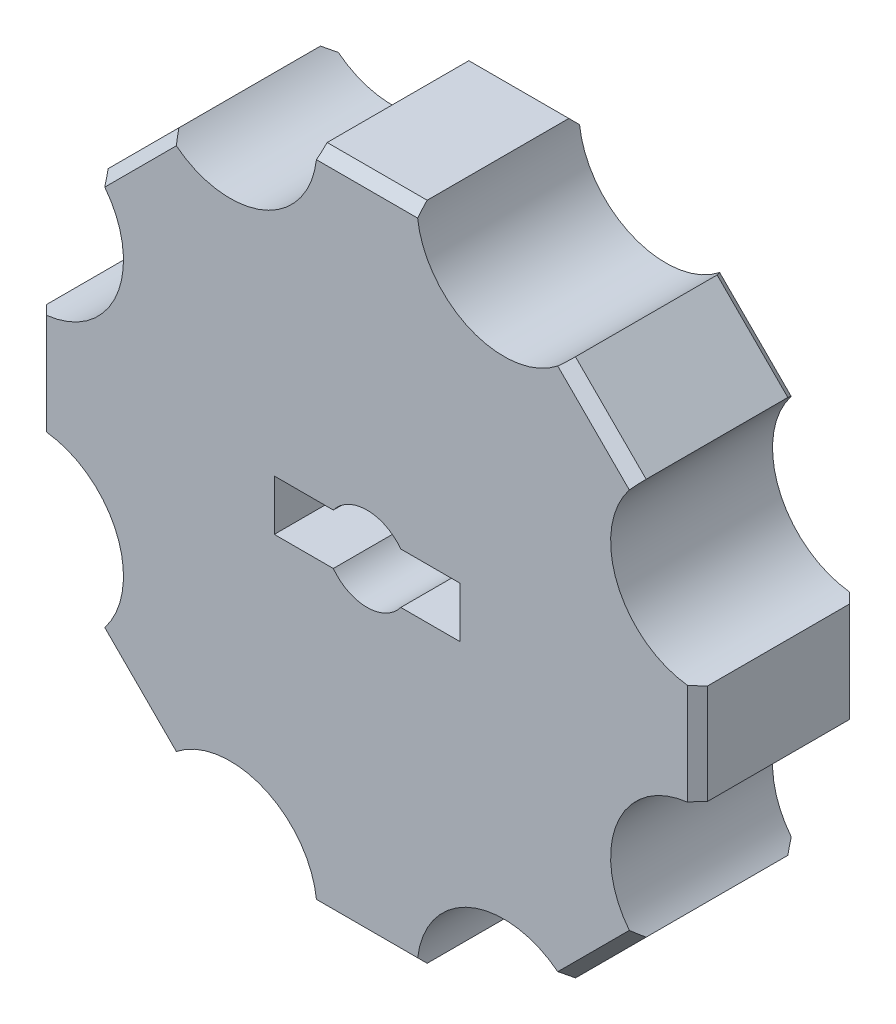
from build123d import *

# Parameters (mm, degrees)
BOSS_EXTRUDE1_DEPTH = 9.6
CHAMFER2_SIZE       = 0.6
CUT_EXTRUDE1_DEPTH  = 30.322371079


with BuildPart() as part:
    # Sketch1 → Boss-Extrude1 (new body)
    with BuildSketch(Plane.XY):
        with BuildLine():
            ThreePointArc((-11.756599923, -15.949743136), (-6.144180323, -14.833363466), (-2.965, -19.591343059))
            Line((-2.965, -19.591343059), (2.965, -19.591343059))
            ThreePointArc((2.965, -19.591343059), (6.144180323, -14.833363466), (11.756599923, -15.949743136))
            Line((11.756599923, -15.949743136), (15.949743136, -11.756599923))
            ThreePointArc((15.949743136, -11.756599923), (14.833363466, -6.144180323), (19.591343059, -2.965))
            Line((19.591343059, -2.965), (19.591343059, 2.965))
            ThreePointArc((19.591343059, 2.965), (14.833363466, 6.144180323), (15.949743136, 11.756599923))
            Line((15.949743136, 11.756599923), (11.756599923, 15.949743136))
            ThreePointArc((11.756599923, 15.949743136), (6.144180323, 14.833363466), (2.965, 19.591343059))
            Line((2.965, 19.591343059), (-2.965, 19.591343059))
            ThreePointArc((-2.965, 19.591343059), (-6.144180323, 14.833363466), (-11.756599923, 15.949743136))
            Line((-11.756599923, 15.949743136), (-15.949743136, 11.756599923))
            ThreePointArc((-15.949743136, 11.756599923), (-14.833363466, 6.144180323), (-19.591343059, 2.965))
            Line((-19.591343059, 2.965), (-19.591343059, -2.965))
            ThreePointArc((-19.591343059, -2.965), (-14.833363466, -6.144180323), (-15.949743136, -11.756599923))
            Line((-15.949743136, -11.756599923), (-11.756599923, -15.949743136))
        make_face()
    extrude(amount=BOSS_EXTRUDE1_DEPTH)

    # Chamfer2
    chamfer2_edges = [part.edges().sort_by_distance(p)[0] for p in [
        (0, -19.591343059, 0),
        (-13.853171529, -13.853171529, 0),
        (-19.591343059, 0, 0),
        (-13.853171529, 13.853171529, 0),
        (0, 19.591343059, 0),
        (13.853171529, 13.853171529, 0),
        (19.591343059, 0, 0),
        (13.853171529, -13.853171529, 0),
        (-13.853171529, 13.853171529, 9.6),
        (0, 19.591343059, 9.6),
        (13.853171529, 13.853171529, 9.6),
        (19.591343059, 0, 9.6),
        (13.853171529, -13.853171529, 9.6),
        (0, -19.591343059, 9.6),
        (-13.853171529, -13.853171529, 9.6),
        (-19.591343059, 0, 9.6),
    ]]
    chamfer(chamfer2_edges, length=CHAMFER2_SIZE)

    # Sketch3 → Cut-Extrude1 (cut, through all)
    with BuildSketch(Plane.XY.offset(9.6)):
        with BuildLine():
            Line((-2, -1.5), (-5.5, -1.5))
            Line((-5.5, -1.5), (-5.5, 1.5))
            Line((-5.5, 1.5), (-2, 1.5))
            ThreePointArc((-2, 1.5), (0, 2.5), (2, 1.5))
            Line((2, 1.5), (5.5, 1.5))
            Line((5.5, 1.5), (5.5, -1.5))
            Line((5.5, -1.5), (2, -1.5))
            ThreePointArc((2, -1.5), (0, -2.5), (-2, -1.5))
        make_face()
    extrude(amount=-CUT_EXTRUDE1_DEPTH, mode=Mode.SUBTRACT)


solid = part.part
